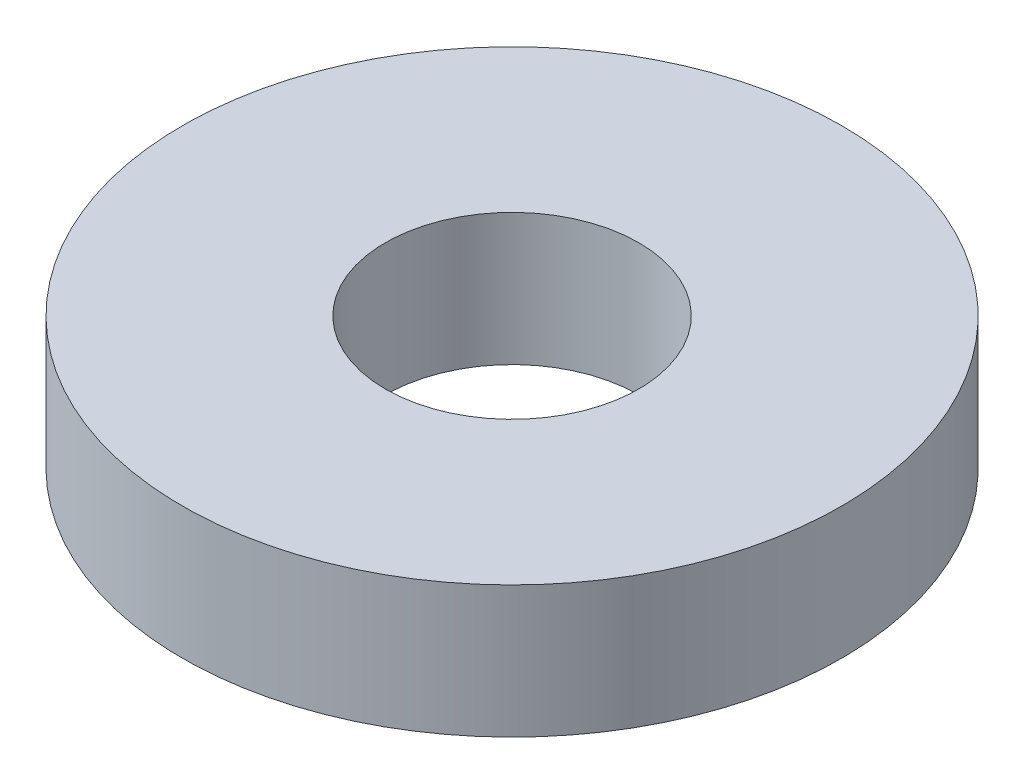
from build123d import *

# Parameters (mm, degrees)
SKETCH1_R           = 65
BOSS_EXTRUDE1_DEPTH = 26
SKETCH2_R           = 25
CUT_EXTRUDE1_DEPTH  = 96.530099969


with BuildPart() as part:
    # Sketch1 → Boss-Extrude1 (new body)
    with BuildSketch(Plane(origin=(0, 0, 0), x_dir=(1, 0, 0), z_dir=(0, 1, 0))):
        Circle(SKETCH1_R)
    extrude(amount=BOSS_EXTRUDE1_DEPTH)

    # Sketch2 → Cut-Extrude1 (cut, through all)
    with BuildSketch(Plane(origin=(0, 0, 0), x_dir=(1, 0, 0), z_dir=(0, 1, 0))):
        Circle(SKETCH2_R)
    extrude(amount=CUT_EXTRUDE1_DEPTH, mode=Mode.SUBTRACT)


solid = part.part
